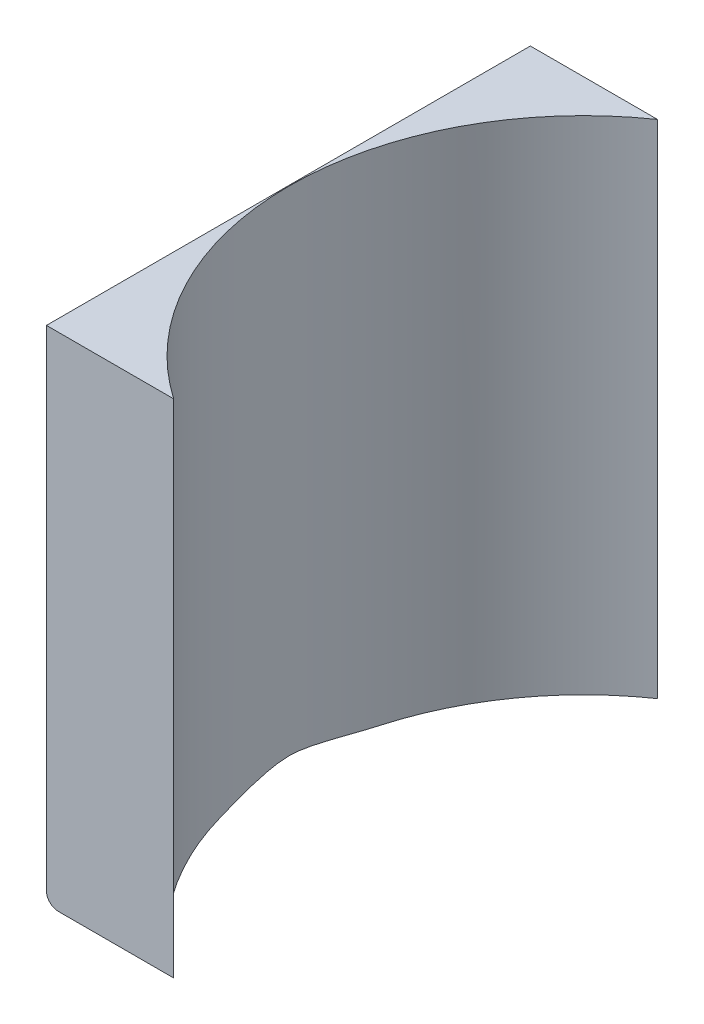
from build123d import *

# Parameters (mm, degrees)
SKETCH_1_W          = 25
SKETCH_1_H          = 41
EXTRUDE_1_DEPTH     = 42.5
FILLET_1_R          = 1
SKETCH_2_R          = 24.95
CUT_EXTRUDE_1_DEPTH = 42.5


with BuildPart() as part:
    # Эскиз1 → Бобышка-Вытянуть1 (new body)
    with BuildSketch(Plane(origin=(0, 0, 0), x_dir=(1, 0, 0), z_dir=(0, 1, 0))):
        Rectangle(SKETCH_1_W, SKETCH_1_H)
    extrude(amount=EXTRUDE_1_DEPTH)

    # Скругление1
    fillet_1_edges = [part.edges().sort_by_distance(p)[0] for p in [
        (-12.5, 0, 0),
    ]]
    fillet(fillet_1_edges, radius=FILLET_1_R)

    # Эскиз2 → Вырез-Вытянуть1 (cut)
    with BuildSketch(Plane(origin=(0, 42.5, 0), x_dir=(1, 0, 0), z_dir=(0, 1, 0))):
        with Locations((12.5, 0)):
            Circle(SKETCH_2_R)
    extrude(amount=-CUT_EXTRUDE_1_DEPTH, mode=Mode.SUBTRACT)


solid = part.part
